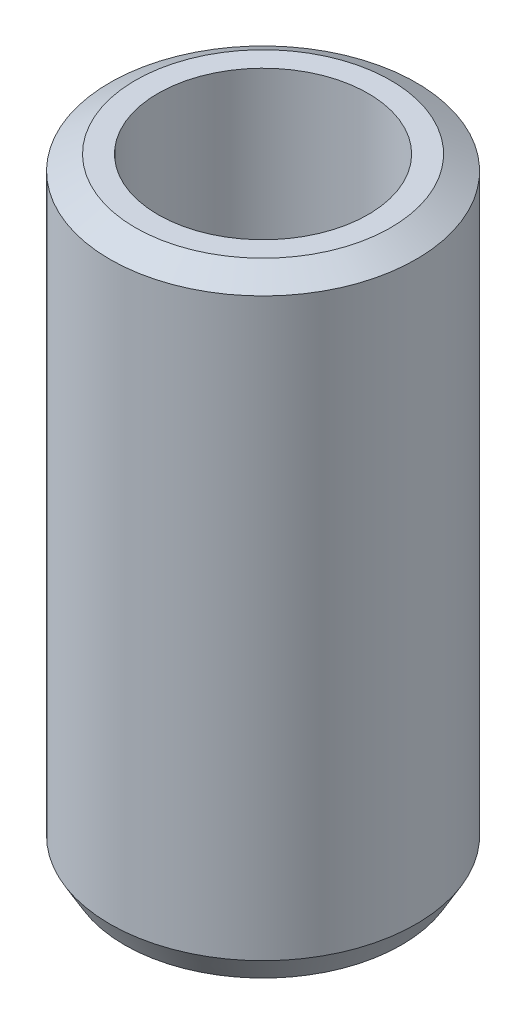
from build123d import *
from OCP.BRepFilletAPI import BRepFilletAPI_MakeChamfer

# Parameters (mm, degrees)
SKETCH1_R           = 40
BOSS_EXTRUDE1_DEPTH = 160.872735311
SKETCH2_R           = 27.448967037
CUT_EXTRUDE1_DEPTH  = 171.528698367
CHAMFER1_SIZE       = 3.838369139
CHAMFER1_SIZE2      = 6.648250366


with BuildPart() as part:
    # Sketch1 → Boss-Extrude1 (new body)
    with BuildSketch(Plane(origin=(0, 0, 0), x_dir=(1, 0, 0), z_dir=(0, 1, 0))):
        Circle(SKETCH1_R)
    extrude(amount=BOSS_EXTRUDE1_DEPTH)

    # Sketch2 → Cut-Extrude1 (cut, through all)
    with BuildSketch(Plane(origin=(0, 0, 0), x_dir=(1, 0, 0), z_dir=(0, 1, 0))):
        Circle(SKETCH2_R)
    extrude(amount=CUT_EXTRUDE1_DEPTH, mode=Mode.SUBTRACT)

    # Chamfer1: one chamfer whose edges measure the first distance from different faces: ONE call of the kernel's chamfer builder (chamfer() names one face for all edges)
    chamfer1_edges_1 = [part.edges().sort_by_distance(p)[0] for p in [
        (-40, 160.872735311, 0),
    ]]
    chamfer1_side_1 = [part.faces().sort_by_distance(p)[0] for p in [
        (-40, 80.436367656, 0),
    ]]
    chamfer1_edges_2 = [part.edges().sort_by_distance(p)[0] for p in [
        (-40, 0, 0),
    ]]
    chamfer1_side_2 = [part.faces().sort_by_distance(p)[0] for p in [
        (-38.86862915, 0, 0),
    ]]
    chamfer1 = BRepFilletAPI_MakeChamfer(part.part.solid().wrapped)
    for e in chamfer1_edges_1:
        chamfer1.Add(CHAMFER1_SIZE, CHAMFER1_SIZE2, e.wrapped, chamfer1_side_1[0].wrapped)  # the first distance lies on this face
    for e in chamfer1_edges_2:
        chamfer1.Add(CHAMFER1_SIZE, CHAMFER1_SIZE2, e.wrapped, chamfer1_side_2[0].wrapped)  # the first distance lies on this face
    add(Compound.cast(chamfer1.Shape()), mode=Mode.REPLACE)


solid = part.part
